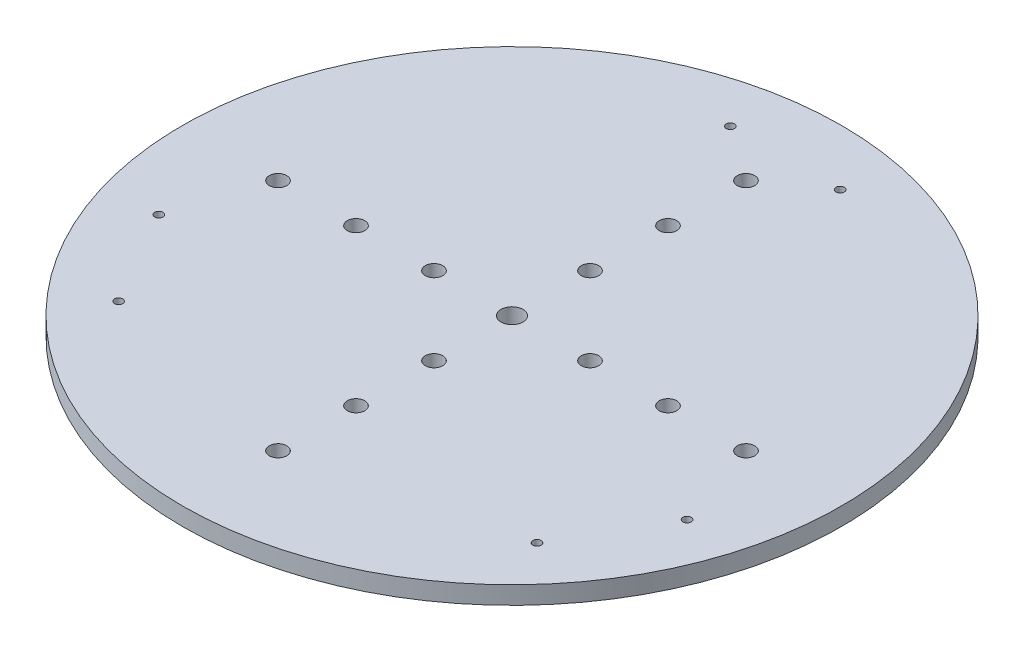
from build123d import *

# Parameters (mm, degrees)
CROQUIS1_R              = 120
SALIENTE_EXTRUIR1_DEPTH = 6.5
CROQUIS2_R              = 4
CORTAR_EXTRUIR1_DEPTH   = 6.5
CROQUIS3_R              = 3.175
CORTAR_EXTRUIR2_DEPTH   = 6.5
CROQUIS4_R              = 1.5
CORTAR_EXTRUIR3_DEPTH   = 10


with BuildPart() as part:
    # Croquis1 → Saliente-Extruir1 (new body)
    with BuildSketch(Plane(origin=(0, 0, 0), x_dir=(1, 0, 0), z_dir=(0, 1, 0))):
        Circle(CROQUIS1_R)
    extrude(amount=SALIENTE_EXTRUIR1_DEPTH)

    # Croquis2 → Cortar-Extruir1 (cut)
    with BuildSketch(Plane(origin=(0, 6.5, 0), x_dir=(1, 0, 0), z_dir=(0, 1, 0))):
        Circle(CROQUIS2_R)
    extrude(amount=-CORTAR_EXTRUIR1_DEPTH, mode=Mode.SUBTRACT)

    # Croquis3 → Cortar-Extruir2 (cut)
    with BuildSketch(Plane(origin=(0, 0, 0), x_dir=(-1, 0, 0), z_dir=(0, -1, 0))):
        with Locations((-28.4, 0)):
            Circle(CROQUIS3_R)
        with Locations((-56.8, 0)):
            Circle(CROQUIS3_R)
        with Locations((-85.2, 0)):
            Circle(CROQUIS3_R)
        with Locations((85.2, 0)):
            Circle(CROQUIS3_R)
        with Locations((56.8, 0)):
            Circle(CROQUIS3_R)
        with Locations((28.4, 0)):
            Circle(CROQUIS3_R)
        with Locations((0, -28.4)):
            Circle(CROQUIS3_R)
        with Locations((0, -56.8)):
            Circle(CROQUIS3_R)
        with Locations((0, -85.2)):
            Circle(CROQUIS3_R)
        with Locations((0, 85.2)):
            Circle(CROQUIS3_R)
        with Locations((0, 56.8)):
            Circle(CROQUIS3_R)
        with Locations((0, 28.4)):
            Circle(CROQUIS3_R)
    extrude(amount=-CORTAR_EXTRUIR2_DEPTH, mode=Mode.SUBTRACT)

    # Croquis4 → Cortar-Extruir3 (cut)
    with BuildSketch(Plane.XZ):
        with Locations((20, -99.505571576)):
            Circle(CROQUIS4_R)
        with Locations((-20, -99.505571576)):
            Circle(CROQUIS4_R)
        with Locations((-96.174352803, 32.432277712)):
            Circle(CROQUIS4_R)
        with Locations((-76.174352803, 67.073293864)):
            Circle(CROQUIS4_R)
        with Locations((76.174352803, 67.073293864)):
            Circle(CROQUIS4_R)
        with Locations((96.174352803, 32.432277712)):
            Circle(CROQUIS4_R)
    extrude(amount=-CORTAR_EXTRUIR3_DEPTH, mode=Mode.SUBTRACT)


solid = part.part
